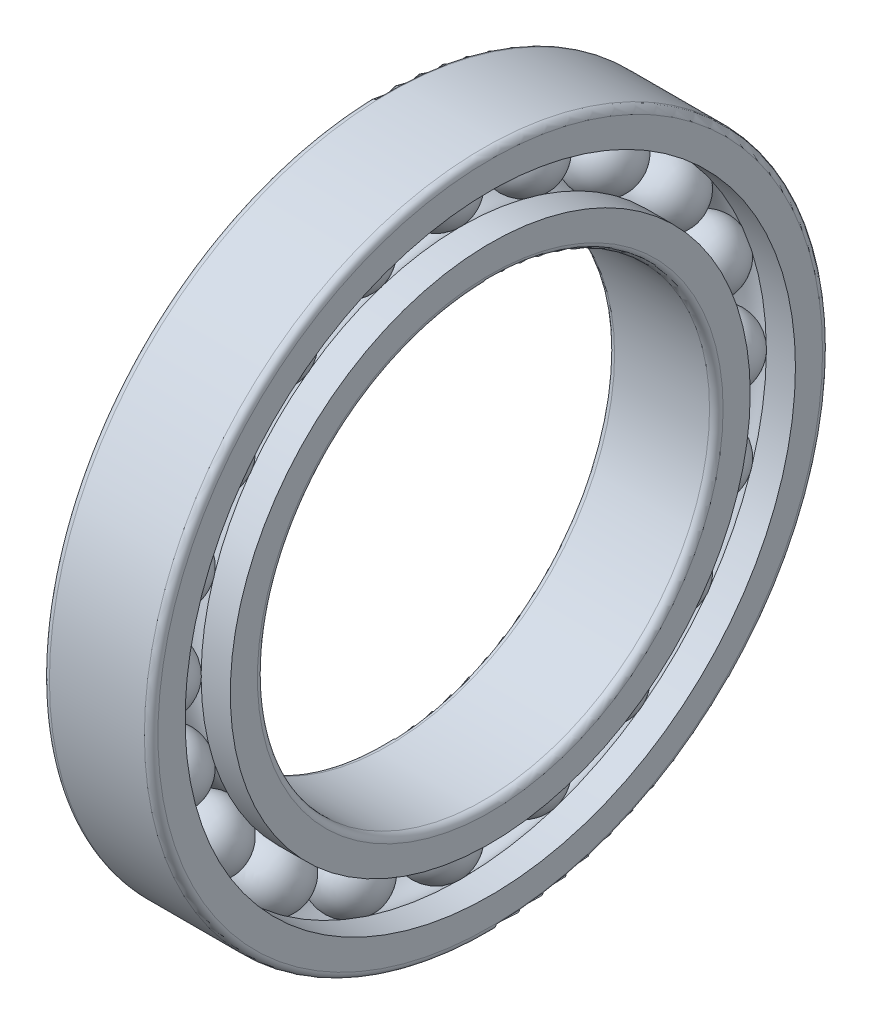
from build123d import *

# Parameters (mm, degrees)
CAGSPISKE_W         = 1.5
CAGSPISKE_H         = 2.5
CAGESPINE_ANGLE     = 0.001
BALLSDETAILED_COUNT = 20
BALLSDETAILED_ANGLE = 342


with BuildPart() as part:
    # CagSpiSke → CageSpine (revolve)
    with BuildSketch(Plane.XY):
        with Locations((0, 62.5)):
            Rectangle(CAGSPISKE_W, CAGSPISKE_H)
    revolve(axis=Axis((-20.6375, 0, 0), (-1, 0, 0)), revolution_arc=CAGESPINE_ANGLE)

    # BalDetSke → BallDetailed (revolve)
    with BuildSketch(Plane.XY):
        with BuildLine():
            Line((-7.5, 62.5), (7.5, 62.5))
            ThreePointArc((7.5, 62.5), (0, 55), (-7.5, 62.5))
        make_face()
    balldetailed = revolve(axis=Axis((-1.905, 62.5, 0), (1, 0, 0)))

    # InnRacSke → InnerRace (revolve)
    with BuildSketch(Plane.XY):
        with BuildLine():
            Line((-5.556583933, 57.5), (-12, 57.5))
            Line((-12, 57.5), (-12, 51.5))
            ThreePointArc((-12, 51.5), (-11.560660172, 50.439339828), (-10.5, 50))
            Line((-10.5, 50), (10.5, 50))
            ThreePointArc((10.5, 50), (11.560660172, 50.439339828), (12, 51.5))
            Line((12, 51.5), (12, 57.5))
            Line((12, 57.5), (5.556583933, 57.5))
            ThreePointArc((5.556583933, 57.5), (0, 55.025), (-5.556583933, 57.5))
        make_face()
    revolve(axis=Axis((-20.6375, 0, 0), (1, 0, 0)))

    # OutRacSke → OuterRace (revolve)
    with BuildSketch(Plane.XY):
        with BuildLine():
            Line((-5.556583933, 67.5), (-12, 67.5))
            Line((-12, 67.5), (-12, 73.5))
            ThreePointArc((-12, 73.5), (-11.560660172, 74.560660172), (-10.5, 75))
            Line((-10.5, 75), (10.5, 75))
            ThreePointArc((10.5, 75), (11.560660172, 74.560660172), (12, 73.5))
            Line((12, 73.5), (12, 67.5))
            Line((12, 67.5), (5.556583933, 67.5))
            ThreePointArc((5.556583933, 67.5), (0, 69.975), (-5.556583933, 67.5))
        make_face()
    revolve(axis=Axis((-20.6375, 0, 0), (1, 0, 0)))

    # BallsDetailed: BallDetailed ×20 about axis
    ballsdetailed_axis = Axis((-50, 0, 0), (1, 0, 0))
    for i in range(1, BALLSDETAILED_COUNT):
        add(balldetailed.rotate(ballsdetailed_axis, i * BALLSDETAILED_ANGLE / (BALLSDETAILED_COUNT - 1)))


solid = part.part
